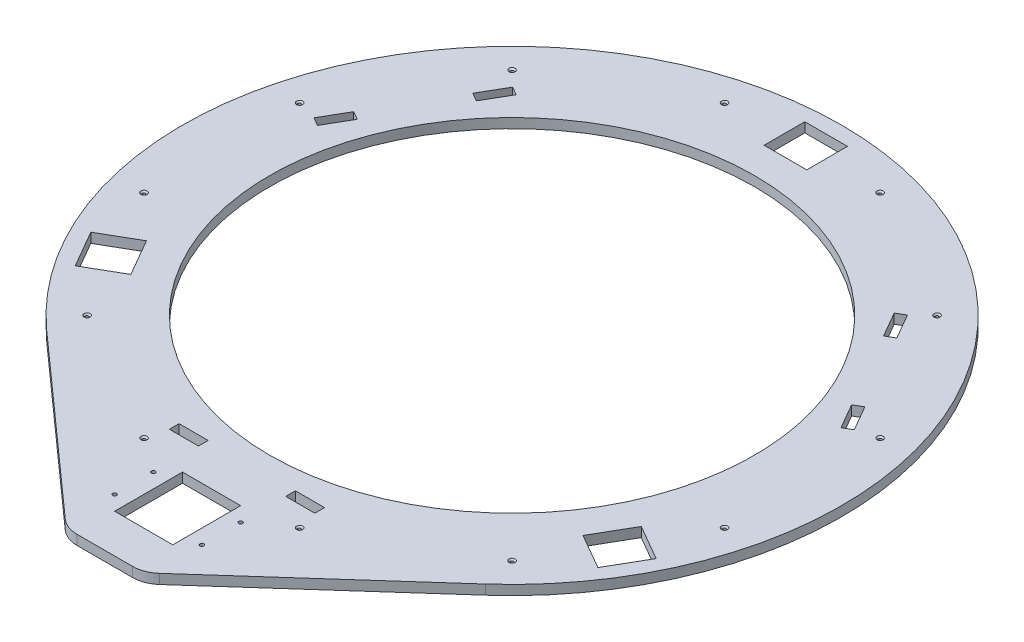
from build123d import *

# Parameters (mm, degrees)
SKETCH1_R                                       = 340
SKETCH1_R_2                                     = 250
BOSS_EXTRUDE1_DEPTH                             = 10
SKETCH7_W                                       = 30
SKETCH7_H                                       = 10
CUT_EXTRUDE2_DEPTH                              = 10
CIRPATTERN3_COUNT                               = 3
BOSS_EXTRUDE3_DEPTH                             = 10
SKETCH9_W                                       = 60
SKETCH9_H                                       = 70
CUT_EXTRUDE3_DEPTH                              = 10
CUT_EXTRUDE4_DEPTH                              = 10
CIRPATTERN4_COUNT                               = 3
SKETCH11_R                                      = 2
CUT_EXTRUDE5_DEPTH                              = 10
FILLET1_R                                       = 30
CSK_FOR_M3_FLAT_HEAD_MACHINE_SCREW1_D           = 3.4
CSK_FOR_M3_FLAT_HEAD_MACHINE_SCREW1_CSINK_D     = 6.3
CSK_FOR_M3_FLAT_HEAD_MACHINE_SCREW1_CSINK_ANGLE = 90


with BuildPart() as part:
    # Sketch1 → Boss-Extrude1 (new body)
    with BuildSketch(Plane(origin=(0, 82.464823413, 0), x_dir=(1, 0, 0), z_dir=(0, 1, 0))):
        Circle(SKETCH1_R)
        Circle(SKETCH1_R_2, mode=Mode.SUBTRACT)
    extrude(amount=-BOSS_EXTRUDE1_DEPTH)

    # Sketch7 → Cut-Extrude2 (cut)
    with BuildSketch(Plane.XZ.offset(-72.464823413)):
        with Locations((60, 273.5)):
            Rectangle(SKETCH7_W, SKETCH7_H)
        with Locations((-60, 273.5)):
            Rectangle(SKETCH7_W, SKETCH7_H)
    cut_extrude2 = extrude(amount=-CUT_EXTRUDE2_DEPTH, mode=Mode.SUBTRACT)

    # CirPattern3: Cut-Extrude2 ×3 about axis
    cirpattern3_axis = Axis((0, 72.464823413, 0), (0, 1, 0))
    for i in range(1, CIRPATTERN3_COUNT):
        add(cut_extrude2.rotate(cirpattern3_axis, i * 360 / CIRPATTERN3_COUNT), mode=Mode.SUBTRACT)

    # Sketch8 → Boss-Extrude3 (add)
    with BuildSketch(Plane(origin=(0, 82.464823413, 0), x_dir=(1, 0, 0), z_dir=(0, 1, 0))):
        with BuildLine():
            Line((-40, -420), (40, -420))
            Line((40, -420), (226.378812173, -253.678208364))
            ThreePointArc((226.378812173, -253.678208364), (0, -340), (-226.378812173, -253.678208364))
            Line((-226.378812173, -253.678208364), (-40, -420))
        make_face()
    extrude(amount=-BOSS_EXTRUDE3_DEPTH)

    # Sketch9 → Cut-Extrude3 (cut)
    with BuildSketch(Plane(origin=(0, 82.464823413, 0), x_dir=(1, 0, 0), z_dir=(0, 1, 0))):
        with Locations((0, -345)):
            Rectangle(SKETCH9_W, SKETCH9_H)
    extrude(amount=-CUT_EXTRUDE3_DEPTH, mode=Mode.SUBTRACT)

    # Sketch10 → Cut-Extrude4 (cut)
    with BuildSketch(Plane(origin=(0, 82.464823413, 0), x_dir=(1, 0, 0), z_dir=(0, 1, 0))):
        Polygon((233.219163867, -160.052558883), (255.219163867, -121.947441117), (291.592230826, -142.947441117), (269.592230826, -181.052558883), align=None)
    cut_extrude4 = extrude(amount=-CUT_EXTRUDE4_DEPTH, mode=Mode.SUBTRACT)

    # CirPattern4: Cut-Extrude4 ×3 about axis
    cirpattern4_axis = Axis((0, 82.464823413, 0), (0, 1, 0))
    for i in range(1, CIRPATTERN4_COUNT):
        add(cut_extrude4.rotate(cirpattern4_axis, i * 360 / CIRPATTERN4_COUNT), mode=Mode.SUBTRACT)

    # Sketch11 → Cut-Extrude5 (cut)
    with BuildSketch(Plane(origin=(0, 82.464823413, 0), x_dir=(1, 0, 0), z_dir=(0, 1, 0))):
        with Locations((-45, -365)):
            Circle(SKETCH11_R)
        with Locations((-45, -325)):
            Circle(SKETCH11_R)
        with Locations((45, -365)):
            Circle(SKETCH11_R)
        with Locations((45, -325)):
            Circle(SKETCH11_R)
    extrude(amount=-CUT_EXTRUDE5_DEPTH, mode=Mode.SUBTRACT)

    # Fillet1
    fillet1_edges = [part.edges().sort_by_distance(p)[0] for p in [
        (40, 77.464823413, 420),
        (-40, 77.464823413, 420),
    ]]
    fillet(fillet1_edges, radius=FILLET1_R)

    # CSK for M3 Flat Head Machine Screw1 (through all)
    with Locations(Plane(origin=(0, 82.464823413, 0), x_dir=(1, 0, 0), z_dir=(0, 1, 0))):
        with Locations((80.233903982, 299.43700615), (219.203102168, 219.203102168), (299.43700615, 80.233903982), (299.43700615, -80.233903982), (219.203102168, -219.203102168), (80.233903982, -299.43700615), (-80.233903982, -299.43700615), (-219.203102168, -219.203102168), (-299.43700615, -80.233903982), (-299.43700615, 80.233903982), (-219.203102168, 219.203102168), (-80.233903982, 299.43700615), (0, 0)):
            CounterSinkHole(CSK_FOR_M3_FLAT_HEAD_MACHINE_SCREW1_D / 2, CSK_FOR_M3_FLAT_HEAD_MACHINE_SCREW1_CSINK_D / 2, counter_sink_angle=CSK_FOR_M3_FLAT_HEAD_MACHINE_SCREW1_CSINK_ANGLE)


solid = part.part
